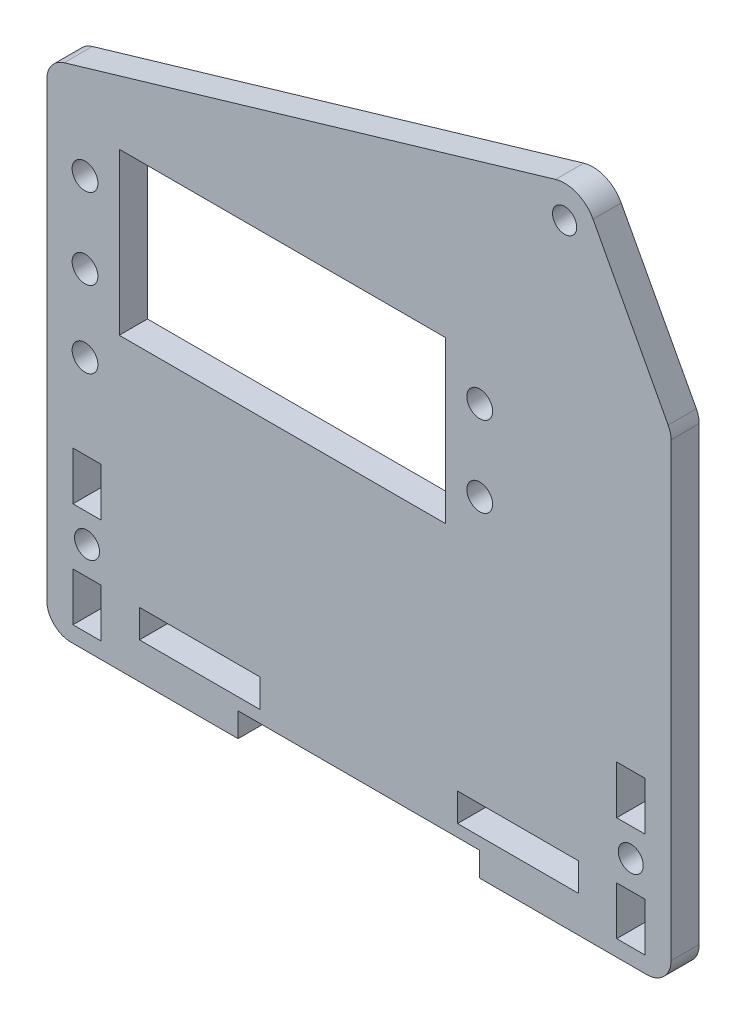
from build123d import *

# Parameters (mm, degrees)
SKETCH1_R           = 1.5
SKETCH1_W           = 40.5
SKETCH1_H           = 20
BOSS_EXTRUDE1_DEPTH = 3.5
SKETCH2_R           = 1.55
SKETCH2_W           = 3.5
SKETCH2_H           = 6
CUT_EXTRUDE1_DEPTH  = 63.568462503
SKETCH3_W           = 15
SKETCH3_H           = 3.5
CUT_EXTRUDE2_DEPTH  = 63.568462503
SKETCH4_R           = 1.6
CUT_EXTRUDE3_DEPTH  = 63.568462503
CUT_EXTRUDE5_REACH  = 64.568
SKETCH5_R           = 1.6
SKETCH6_W           = 30
SKETCH6_H           = 3
CUT_EXTRUDE6_DEPTH  = 10


with BuildPart() as part:
    # Sketch1 → Boss-Extrude1 (new body)
    with BuildSketch(Plane.XY):
        with BuildLine():
            Line((-35.75, -31), (35.75, -31))
            ThreePointArc((35.75, -31), (37.871320344, -30.121320344), (38.75, -28))
            Line((38.75, -28), (38.75, 28))
            ThreePointArc((38.75, 28), (38.66026354, 28.728262404), (38.396422581, 29.412957015))
            Line((38.396422581, 29.412957015), (29.068452082, 46.883942686))
            ThreePointArc((29.068452082, 46.883942686), (27.086681109, 48.688825431), (24.410301911, 48.837190876))
            Line((24.410301911, 48.837190876), (-36.597190048, 30.877893157))
            ThreePointArc((-36.597190048, 30.877893157), (-38.152245839, 29.79700165), (-38.75, 28))
            Line((-38.75, 28), (-38.75, -28))
            ThreePointArc((-38.75, -28), (-37.871320344, -30.121320344), (-35.75, -31))
        make_face()
        with Locations((25.539888641, 45)):
            Circle(SKETCH1_R, mode=Mode.SUBTRACT)
        with Locations((-9.5, 15)):
            Rectangle(SKETCH1_W, SKETCH1_H, mode=Mode.SUBTRACT)
    extrude(amount=BOSS_EXTRUDE1_DEPTH)

    # Sketch2 → Cut-Extrude1 (cut, through all)
    with BuildSketch(Plane(origin=(0, 0, 0), x_dir=(-1, 0, 0), z_dir=(0, 0, -1))):
        with Locations((-33.75, -19.5)):
            Circle(SKETCH2_R)
        with Locations((33.75, -19.5)):
            Circle(SKETCH2_R)
        with Locations((-33.75, -13)):
            Rectangle(SKETCH2_W, SKETCH2_H)
        with Locations((-33.75, -26)):
            Rectangle(SKETCH2_W, SKETCH2_H)
        with Locations((33.75, -26)):
            Rectangle(SKETCH2_W, SKETCH2_H)
        with Locations((33.75, -13)):
            Rectangle(SKETCH2_W, SKETCH2_H)
    extrude(amount=-CUT_EXTRUDE1_DEPTH, mode=Mode.SUBTRACT)

    # Sketch3 → Cut-Extrude2 (cut, through all)
    with BuildSketch(Plane(origin=(0, 0, 0), x_dir=(-1, 0, 0), z_dir=(0, 0, -1))):
        with Locations((19.75, -24.75)):
            Rectangle(SKETCH3_W, SKETCH3_H)
        with Locations((-19.75, -24.75)):
            Rectangle(SKETCH3_W, SKETCH3_H)
    extrude(amount=-CUT_EXTRUDE2_DEPTH, mode=Mode.SUBTRACT)

    # Sketch4 → Cut-Extrude3 (cut, through all)
    with BuildSketch(Plane(origin=(0, 0, 0), x_dir=(-1, 0, 0), z_dir=(0, 0, -1))):
        with Locations((-15, 20)):
            Circle(SKETCH4_R)
        with Locations((-15, 10)):
            Circle(SKETCH4_R)
        with Locations((34, 10)):
            Circle(SKETCH4_R)
        with Locations((34, 20)):
            Circle(SKETCH4_R)
    extrude(amount=-CUT_EXTRUDE3_DEPTH, mode=Mode.SUBTRACT)

    # Sketch5 → Cut-Extrude5 (cut, up to next)
    with BuildSketch(Plane(origin=(0, 0, 0), x_dir=(-1, 0, 0), z_dir=(0, 0, -1)), mode=Mode.PRIVATE) as cut_extrude5_sk1:
        with Locations((34, 0.5)):
            Circle(SKETCH5_R)
    cut_extrude5_tool1 = extrude(cut_extrude5_sk1.sketch, amount=-CUT_EXTRUDE5_REACH, mode=Mode.PRIVATE) & part.part
    add(cut_extrude5_tool1.solids().sort_by_distance((-34, 0.5, 0))[0], mode=Mode.SUBTRACT)

    # Sketch6 → Cut-Extrude6 (cut)
    with BuildSketch(Plane.XY.offset(3.5)):
        with Locations((0, -29.5)):
            Rectangle(SKETCH6_W, SKETCH6_H)
    extrude(amount=-CUT_EXTRUDE6_DEPTH, mode=Mode.SUBTRACT)


solid = part.part
